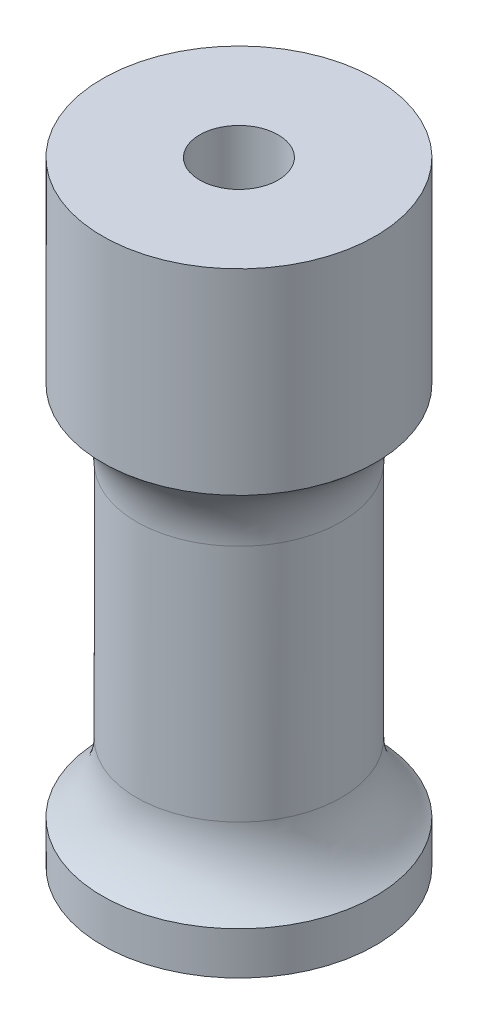
from build123d import *

# Parameters (mm, degrees)
FILLET_1_R = 5


with BuildPart() as part:
    # Эскиз1 → Повернуть1 (revolve)
    with BuildSketch(Plane.XY, mode=Mode.PRIVATE) as revolve_1_sk:
        Polygon((2.3, 0), (2.3, 36), (7.5, 36), (8, 36), (8, 24.5), (6, 24.5), (6, 2.5), (8, 2.5), (8, 0), (6, 0), align=None)
    revolve(revolve_1_sk.sketch.rotate(Axis((0, 0, 0), (0, 1, 0)), 90), axis=Axis((0, 0, 0), (0, 1, 0)))

    # Скругление1
    # the kernel refuses this fillet: 5 mm, written as the material it adds along each edge
    with BuildSketch(Plane(origin=(0, 2.5, 0), x_dir=(0, 0, -1), z_dir=(1, 0, 0))) as fillet_1_piece_1:
        with BuildLine():
            CenterArc((11, 4), FILLET_1_R, 180, 53.130102354)
            Line((8, 0), (7.94, -0.08))
            ThreePointArc((7.94, -0.08), (7, -0.1), (6, -0.1))
            Line((6, -0.1), (5.9, 0))
            Line((5.9, 0), (5.9, 4))
            Line((5.9, 4), (6, 4))
        make_face()
    revolve(axis=Axis((0, 2.5, 0), (0, 1, 0)))
    with BuildSketch(Plane(origin=(0, 24.5, 0), x_dir=(0, 0, -1), z_dir=(1, 0, 0))) as fillet_1_piece_2:
        with BuildLine():
            CenterArc((11, -4), FILLET_1_R, 126.869897646, 53.130102354)
            Line((6, -4), (5.9, -4))
            Line((5.9, -4), (5.9, 0))
            Line((5.9, 0), (6, 0.1))
            ThreePointArc((6, 0.1), (7, 0.1), (7.94, 0.08))
            Line((7.94, 0.08), (8, 0))
        make_face()
    revolve(axis=Axis((0, 24.5, 0), (0, 1, 0)))


solid = part.part
